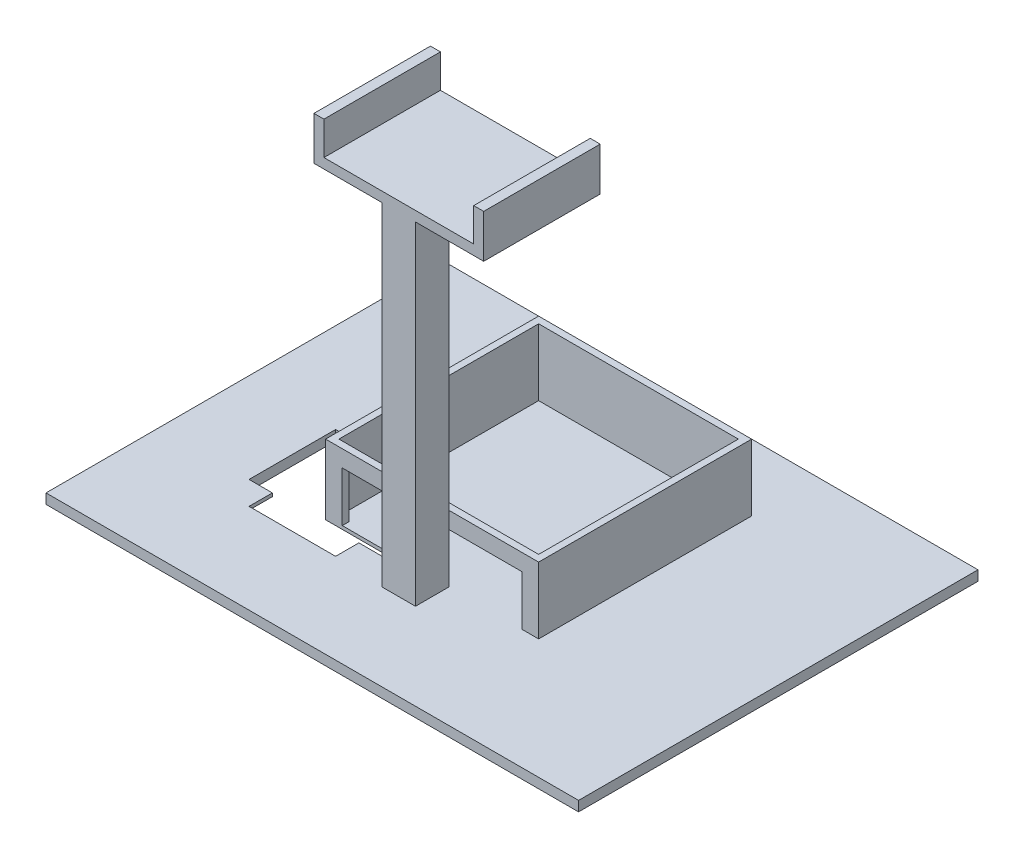
from build123d import *

# Parameters (mm, degrees)
SKETCH1_W           = 160
SKETCH1_H           = 120
BOSS_EXTRUDE1_DEPTH = 3
SKETCH2_R           = 5
CUT_EXTRUDE1_DEPTH  = 2
SKETCH3_W           = 40
SKETCH3_H           = 40
CUT_EXTRUDE2_DEPTH  = 2
CUT_EXTRUDE3_DEPTH  = 1
BOSS_EXTRUDE2_DEPTH = 20
BOSS_EXTRUDE3_DEPTH = 1
SKETCH7_W           = 60
SKETCH7_H           = 60
CUT_EXTRUDE4_DEPTH  = 20
CUT_EXTRUDE5_REACH  = 120.258
SKETCH8_W           = 54
SKETCH8_H           = 15
BOSS_EXTRUDE4_DEPTH = 100
BOSS_EXTRUDE5_DEPTH = 3
SKETCH11_W          = 3
SKETCH11_H          = 35
BOSS_EXTRUDE6_DEPTH = 10


with BuildPart() as part:
    # Sketch1 → Boss-Extrude1 (new body)
    with BuildSketch(Plane(origin=(0, 0, 0), x_dir=(1, 0, 0), z_dir=(0, 1, 0))):
        Rectangle(SKETCH1_W, SKETCH1_H)
    extrude(amount=BOSS_EXTRUDE1_DEPTH)

    # Sketch2 → Cut-Extrude1 (cut)
    with BuildSketch(Plane.XZ):
        with Locations((-70, 50)):
            Circle(SKETCH2_R)
        with Locations((0, 50)):
            Circle(SKETCH2_R)
        with Locations((70, 50)):
            Circle(SKETCH2_R)
        with Locations((-70, 0)):
            Circle(SKETCH2_R)
        with Locations((70, 0)):
            Circle(SKETCH2_R)
        with Locations((-70, -50)):
            Circle(SKETCH2_R)
        with Locations((0, -50)):
            Circle(SKETCH2_R)
        with Locations((70, -50)):
            Circle(SKETCH2_R)
    extrude(amount=-CUT_EXTRUDE1_DEPTH, mode=Mode.SUBTRACT)

    # Sketch3 → Cut-Extrude2 (cut)
    with BuildSketch(Plane.XZ):
        with Locations((-33, 13)):
            Rectangle(SKETCH3_W, SKETCH3_H)
    extrude(amount=-CUT_EXTRUDE2_DEPTH, mode=Mode.SUBTRACT)

    # Sketch4 → Cut-Extrude3 (cut)
    with BuildSketch(Plane.XZ.offset(-2)):
        Polygon((-46, 33), (-20, 33), (-20, 26), (-13, 26), (-13, 0), (-20, 0), (-20, -7), (-46, -7), (-46, 0), (-53, 0), (-53, 26), (-46, 26), align=None)
    extrude(amount=-CUT_EXTRUDE3_DEPTH, mode=Mode.SUBTRACT)

    # Sketch5 → Boss-Extrude2 (add)
    with BuildSketch(Plane(origin=(0, 3, 0), x_dir=(1, 0, 0), z_dir=(0, 1, 0))):
        Polygon((0, 40), (-32, 40), (-32, -24), (32, -24), (32, 40), align=None)
    extrude(amount=BOSS_EXTRUDE2_DEPTH)

    # Sketch6 → Boss-Extrude3 (add)
    with BuildSketch(Plane.XZ.offset(-3)):
        Polygon((-32, 24), (-13, 24), (-13, 0), (-20, 0), (-20, -7), (-32, -7), align=None)
    extrude(amount=BOSS_EXTRUDE3_DEPTH)

    # Sketch7 → Cut-Extrude4 (cut)
    with BuildSketch(Plane(origin=(0, 23, 0), x_dir=(1, 0, 0), z_dir=(0, 1, 0))):
        with Locations((0, 8)):
            Rectangle(SKETCH7_W, SKETCH7_H)
    extrude(amount=-CUT_EXTRUDE4_DEPTH, mode=Mode.SUBTRACT)

    # Sketch8 → Cut-Extrude5 (cut, up to next)
    with BuildSketch(Plane.XY.offset(24), mode=Mode.PRIVATE) as cut_extrude5_sk1:
        with Locations((0, 10.5)):
            Rectangle(SKETCH8_W, SKETCH8_H)
    cut_extrude5_tool1 = extrude(cut_extrude5_sk1.sketch, amount=-CUT_EXTRUDE5_REACH, mode=Mode.PRIVATE) & part.part
    add(cut_extrude5_tool1.solids().sort_by_distance((0, 10.5, 24))[0], mode=Mode.SUBTRACT)

    # Sketch9 → Boss-Extrude4 (add)
    with BuildSketch(Plane(origin=(0, 3, 0), x_dir=(1, 0, 0), z_dir=(0, 1, 0))):
        Polygon((0, -24), (5, -24), (5, -34), (-5, -34), (-5, -24), align=None)
    extrude(amount=BOSS_EXTRUDE4_DEPTH)

    # Sketch10 → Boss-Extrude5 (add)
    with BuildSketch(Plane(origin=(0, 103, 0), x_dir=(1, 0, 0), z_dir=(0, 1, 0))):
        Polygon((0, -34), (25.5, -34), (25.5, 1), (-25.5, 1), (-25.5, -34), align=None)
    extrude(amount=BOSS_EXTRUDE5_DEPTH)

    # Sketch11 → Boss-Extrude6 (add)
    with BuildSketch(Plane(origin=(0, 106, 0), x_dir=(1, 0, 0), z_dir=(0, 1, 0))):
        with Locations((24, -16.5)):
            Rectangle(SKETCH11_W, SKETCH11_H)
        with Locations((-24, -16.5)):
            Rectangle(SKETCH11_W, SKETCH11_H)
    extrude(amount=BOSS_EXTRUDE6_DEPTH)


solid = part.part
